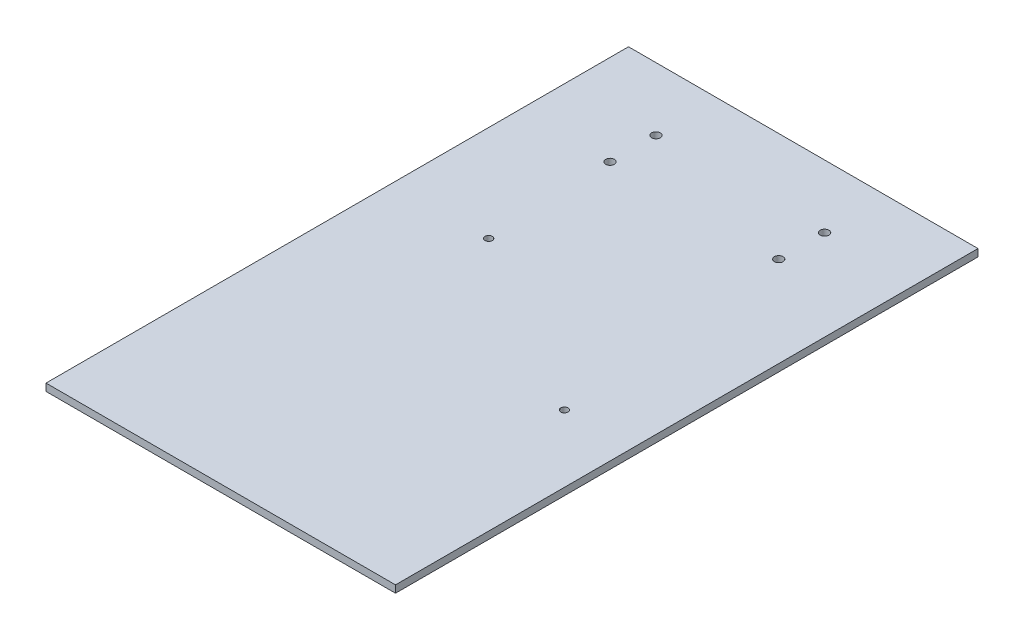
from build123d import *

# Parameters (mm, degrees)
SKETCH1_W             = 152.4
SKETCH1_H             = 254
BOSS_EXTRUDE1_DEPTH   = 3.175
SKETCH4_R             = 1.5875
CUT_EXTRUDE1_DEPTH    = 149.140205971
F_6_CLEARANCE_HOLE1_D = 3.7973


with BuildPart() as part:
    # Sketch1 → Boss-Extrude1 (new body)
    with BuildSketch(Plane(origin=(0, 0, 0), x_dir=(1, 0, 0), z_dir=(0, 1, 0))):
        Rectangle(SKETCH1_W, SKETCH1_H)
    extrude(amount=BOSS_EXTRUDE1_DEPTH)

    # Sketch4 → Cut-Extrude1 (cut, through all)
    with BuildSketch(Plane(origin=(0, 3.175, 0), x_dir=(1, 0, 0), z_dir=(0, 1, 0))):
        with Locations((-34.29, 24.13)):
            Circle(SKETCH4_R)
        with Locations((46.99, -24.13)):
            Circle(SKETCH4_R)
    extrude(amount=-CUT_EXTRUDE1_DEPTH, mode=Mode.SUBTRACT)

    # #6 Clearance Hole1 (through all)
    with Locations(Plane(origin=(0, 3.175, 0), x_dir=(1, 0, 0), z_dir=(0, 1, 0))):
        with Locations((-36.77, 99.54), (-36.77, 79.54), (36.77, 99.54), (36.77, 79.54)):
            Hole(F_6_CLEARANCE_HOLE1_D / 2)


solid = part.part
